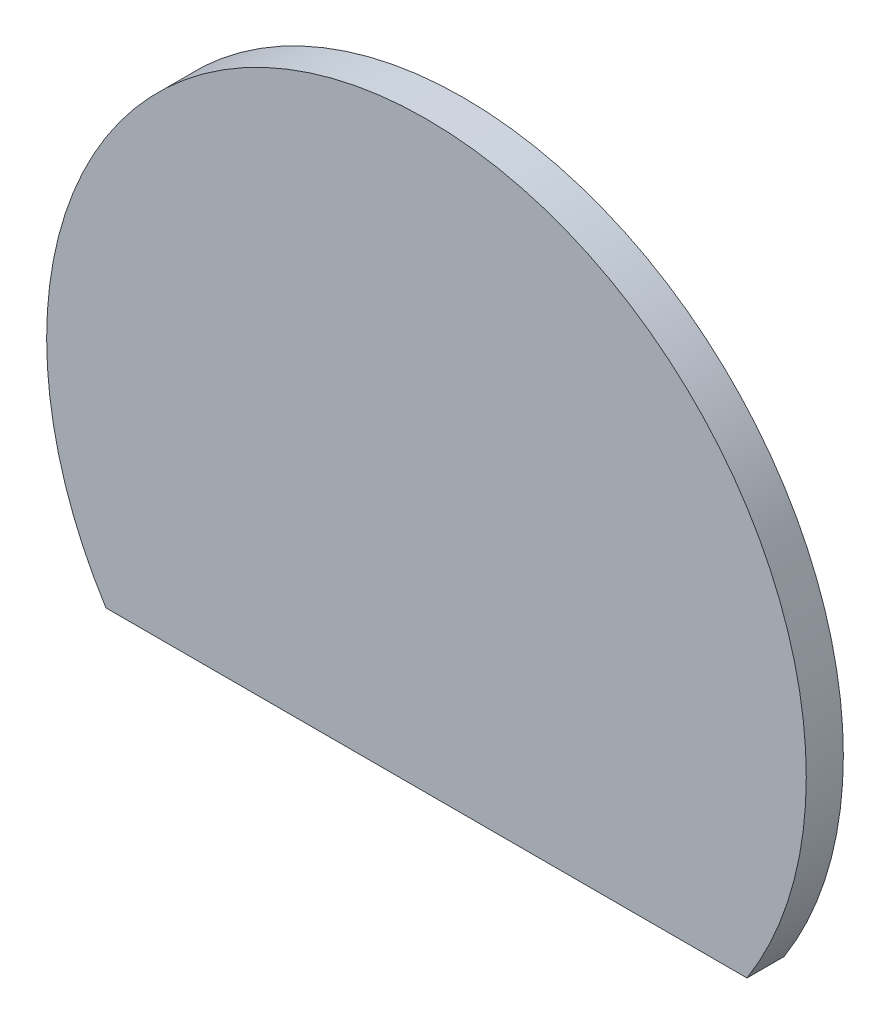
from build123d import *

# Parameters (mm, degrees)
BOSS_EXTRUDE1_DEPTH = 1
SKETCH3_R           = 4.5
SKETCH3_R_2         = 3.5
BOSS_EXTRUDE2_DEPTH = 2.2


with BuildPart() as part:
    # Sketch1 → Boss-Extrude1 (new body)
    with BuildSketch(Plane.XY):
        with BuildLine():
            ThreePointArc((8.649421946, -5.5), (0, 10.25), (-8.649421946, -5.5))
            Line((-8.649421946, -5.5), (8.649421946, -5.5))
        make_face()
    extrude(amount=BOSS_EXTRUDE1_DEPTH)

    # Sketch3 → Boss-Extrude2 (add)
    with BuildSketch(Plane(origin=(0, 0, 0), x_dir=(-1, 0, 0), z_dir=(0, 0, -1))):
        Circle(SKETCH3_R)
        Circle(SKETCH3_R_2, mode=Mode.SUBTRACT)
    extrude(amount=BOSS_EXTRUDE2_DEPTH)


solid = part.part
